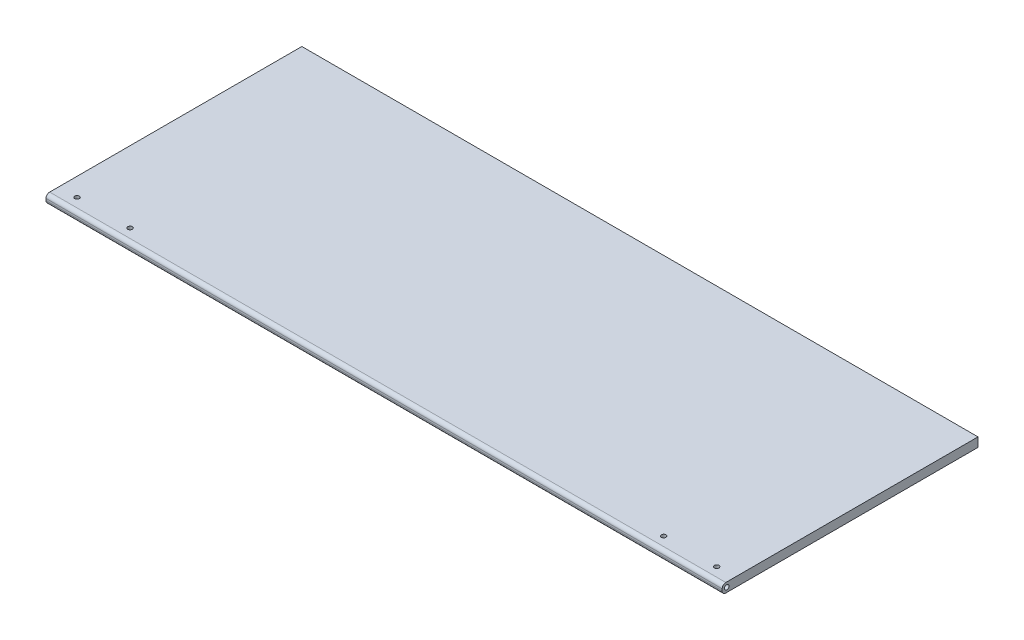
from build123d import *

# Parameters (mm, degrees)
SKETCH1_W           = 469.9
SKETCH1_H           = 177.8
BOSS_EXTRUDE1_DEPTH = 6.35
SKETCH2_R           = 1.5875
CUT_EXTRUDE1_DEPTH  = 479.277683464
FILLET1_R           = 2.54
SKETCH4_R           = 1.5875
CUT_EXTRUDE3_DEPTH  = 252.286758505


with BuildPart() as part:
    # Sketch1 → Boss-Extrude1 (new body)
    with BuildSketch(Plane(origin=(0, 0, 0), x_dir=(1, 0, 0), z_dir=(0, 1, 0))):
        Rectangle(SKETCH1_W, SKETCH1_H)
    extrude(amount=BOSS_EXTRUDE1_DEPTH)

    # Sketch2 → Cut-Extrude1 (cut, through all)
    with BuildSketch(Plane.ZY.offset(234.95)):
        with Locations((85.725, 3.175)):
            Circle(SKETCH2_R)
    extrude(amount=-CUT_EXTRUDE1_DEPTH, mode=Mode.SUBTRACT)

    # Fillet1
    fillet1_edges = [part.edges().sort_by_distance(p)[0] for p in [
        (0, 0, 88.9),
        (0, 6.35, 88.9),
    ]]
    fillet(fillet1_edges, radius=FILLET1_R)

    # Sketch4 → Cut-Extrude3 (cut, through all)
    with BuildSketch(Plane.XZ):
        with Locations((-185.42, 80.01)):
            Circle(SKETCH4_R)
        with Locations((-222.25, 80.01)):
            Circle(SKETCH4_R)
    cut_extrude3 = extrude(amount=-CUT_EXTRUDE3_DEPTH, mode=Mode.SUBTRACT)

    # Mirror1: Cut-Extrude3 across plane
    add(cut_extrude3.mirror(Plane(origin=(0, 0, 0), x_dir=(0, 0, 1), z_dir=(1, 0, 0))), mode=Mode.SUBTRACT)


solid = part.part
